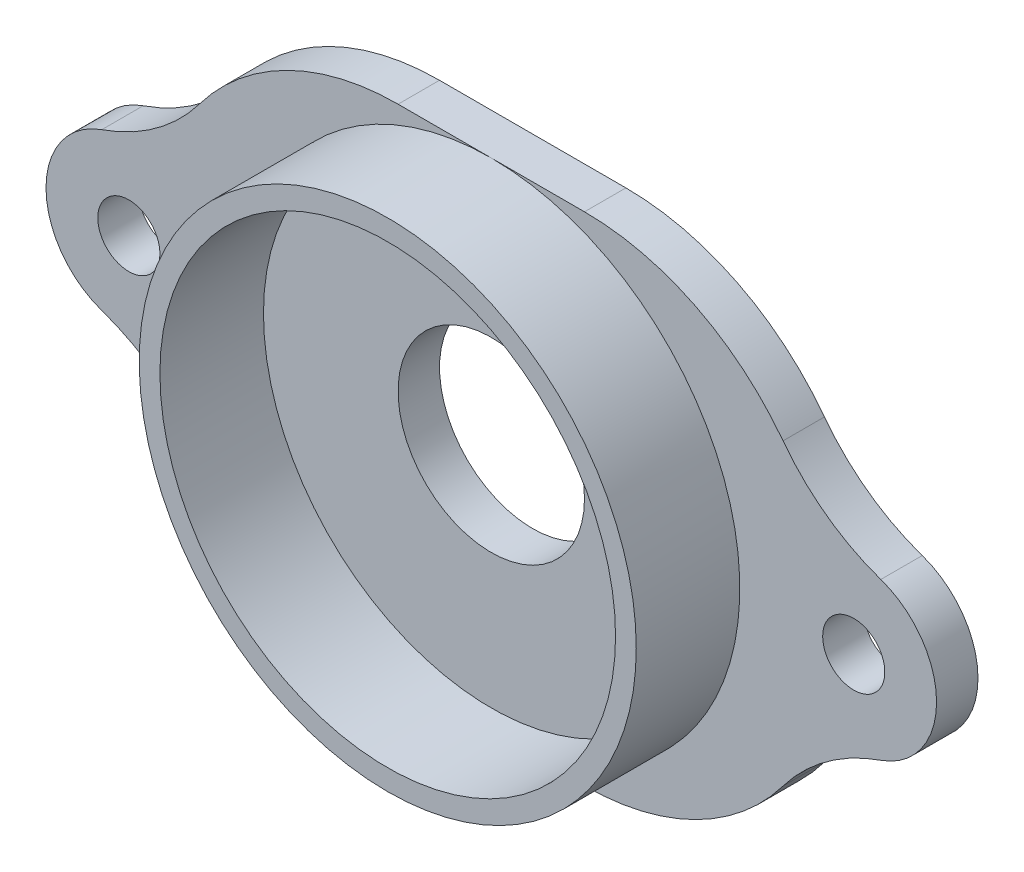
from build123d import *

# Parameters (mm, degrees)
EXTRUDE_2_DEPTH     = 1
SKETCH_3_R          = 12
SKETCH_3_R_2        = 11
EXTRUDE_3_DEPTH     = 5
SKETCH_4_R          = 4.5
CUT_EXTRUDE_1_DEPTH = 26.124689053
SKETCH_5_R          = 1.5
CUT_EXTRUDE_2_DEPTH = 26.597851472


with BuildPart() as part:
    # 草图2 → 凸台-拉伸2 (new, symmetric)
    with BuildSketch(Plane.XY):
        with BuildLine():
            Line((-4.5, 12), (4.5, 12))
            ThreePointArc((4.5, 12), (9.857189903, 10.7378078), (14.087412587, 7.216752724))
            ThreePointArc((14.087412587, 7.216752724), (16.191153731, 5.146301215), (18.807692308, 3.780203808))
            ThreePointArc((18.807692308, 3.780203808), (21.5, 0), (18.807692308, -3.780203808))
            ThreePointArc((18.807692308, -3.780203808), (16.191153731, -5.146301215), (14.087412587, -7.216752724))
            ThreePointArc((14.087412587, -7.216752724), (9.857189903, -10.7378078), (4.5, -12))
            Line((4.5, -12), (-4.5, -12))
            ThreePointArc((-4.5, -12), (-9.857189903, -10.7378078), (-14.087412587, -7.216752724))
            ThreePointArc((-14.087412587, -7.216752724), (-16.191153731, -5.146301215), (-18.807692308, -3.780203808))
            ThreePointArc((-18.807692308, -3.780203808), (-21.5, 0), (-18.807692308, 3.780203808))
            ThreePointArc((-18.807692308, 3.780203808), (-16.191153731, 5.146301215), (-14.087412587, 7.216752724))
            ThreePointArc((-14.087412587, 7.216752724), (-9.857189903, 10.7378078), (-4.5, 12))
        make_face()
    extrude(amount=EXTRUDE_2_DEPTH, both=True)

    # 草图3 → 凸台-拉伸3 (add)
    with BuildSketch(Plane.XY.offset(1)):
        Circle(SKETCH_3_R)
        Circle(SKETCH_3_R_2, mode=Mode.SUBTRACT)
    extrude(amount=EXTRUDE_3_DEPTH)

    # 草图4 → 切除-拉伸1 (cut, through all)
    with BuildSketch(Plane.XY.offset(1)):
        Circle(SKETCH_4_R)
    extrude(amount=-CUT_EXTRUDE_1_DEPTH, mode=Mode.SUBTRACT)

    # 草图5 → 切除-拉伸2 (cut, through all)
    with BuildSketch(Plane(origin=(0, 0, -1), x_dir=(-1, 0, 0), z_dir=(0, 0, -1))):
        with Locations((17.5, 0)):
            Circle(SKETCH_5_R)
        with Locations((-17.5, 0)):
            Circle(SKETCH_5_R)
    extrude(amount=-CUT_EXTRUDE_2_DEPTH, mode=Mode.SUBTRACT)


solid = part.part
